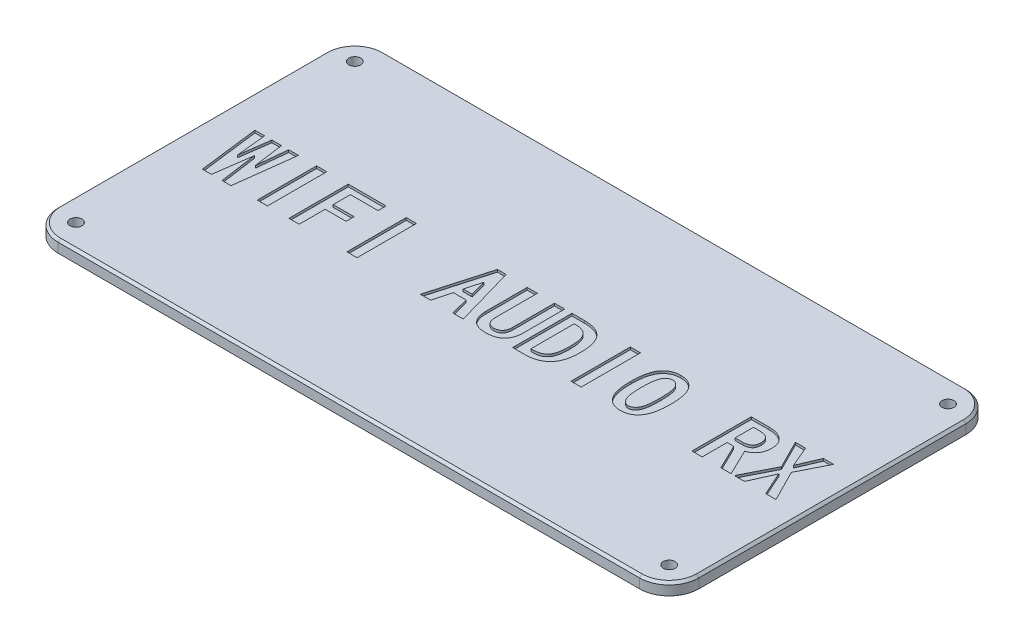
from build123d import *

# Parameters (mm, degrees)
EXTRUDE_1_DEPTH         = 2
SKETCH_2_R              = 1
CUT_EXTRUDE_1_DEPTH     = 2
CHAMFER_1_SIZE          = 0.4
CUT_EXTRUDE_START       = -0.4
CUT_EXTRUDE_2_OUTLINE_W = 1.719253059
CUT_EXTRUDE_2_OUTLINE_H = 10
CUT_EXTRUDE_2_DEPTH     = 0.4


# Read off the part's stored shape, not the designer's step: 切除-拉伸2
with BuildPart() as part:
    # 草图1 → 凸台-拉伸1 (new body)
    with BuildSketch(Plane(origin=(0, 0, 0), x_dir=(1, 0, 0), z_dir=(0, 1, 0))):
        with BuildLine():
            Line((5, 0), (103, 0))
            ThreePointArc((103, 0), (106.535533906, 1.464466094), (108, 5))
            Line((108, 5), (108, 50))
            ThreePointArc((108, 50), (106.535533906, 53.535533906), (103, 55))
            Line((103, 55), (5, 55))
            ThreePointArc((5, 55), (1.464466094, 53.535533906), (0, 50))
            Line((0, 50), (0, 5))
            ThreePointArc((0, 5), (1.464466094, 1.464466094), (5, 0))
        make_face()
    extrude(amount=EXTRUDE_1_DEPTH)

    # 草图2 → 切除-拉伸1 (cut)
    with BuildSketch(Plane(origin=(0, 2, 0), x_dir=(1, 0, 0), z_dir=(0, 1, 0))):
        with Locations(Location((4, 4, 0), (0, 0, 270))):
            Circle(SKETCH_2_R)
        with Locations(Location((4, 51, 0), (0, 0, 270))):
            Circle(SKETCH_2_R)
        with Locations(Location((104, 51, 0), (0, 0, 270))):
            Circle(SKETCH_2_R)
        with Locations(Location((104, 4, 0), (0, 0, 270))):
            Circle(SKETCH_2_R)
    extrude(amount=-CUT_EXTRUDE_1_DEPTH, mode=Mode.SUBTRACT)

    # 倒角1
    chamfer_1_edges = [part.edges().sort_by_distance(p)[0] for p in [
        (106.535533906, 2, -1.464466094),
        (108, 2, -27.5),
        (106.535533906, 2, -53.535533906),
        (54, 2, -55),
        (1.464466094, 2, -53.535533906),
        (0, 2, -27.5),
        (1.464466094, 2, -1.464466094),
        (54, 2, 0),
    ]]
    chamfer(chamfer_1_edges, length=CHAMFER_1_SIZE)

    # 切除-拉伸2 outline → 切除-拉伸2 (cut)
    # profile 1 of 11: a face of its own
    with BuildSketch(Plane(origin=(0, 2, 0), x_dir=(1, 0, 0), z_dir=(0, 1, 0)).offset(CUT_EXTRUDE_START)):
        with BuildLine():
            add(Edge.make_bspline(
                [(92.274759623, 32.541825938), (92.395758709, 32.540026073), (92.63325844, 32.536493258), (92.980362064, 32.501157515), (93.310294433, 32.445631116), (93.622501217, 32.369678066), (93.916277642, 32.267195564), (94.193419921, 32.145888679), (94.453197451, 32.001124187), (94.693158566, 31.834296743), (94.912715593, 31.645541166), (95.102909665, 31.42858605), (95.264653273, 31.18696423), (95.396284975, 30.920597261), (95.496939678, 30.629758131), (95.56979959, 30.31474531), (95.612362483, 29.97448239), (95.61804466, 29.73948626), (95.620971257, 29.618451823)],
                knots=[0, 0, 0, 0, 0.071797487, 0.140925724, 0.206828829, 0.270272655, 0.331376729, 0.391266126, 0.449629048, 0.507587352, 0.564473205, 0.621039575, 0.678279369, 0.73658201, 0.796884002, 0.860542064, 0.92817238, 1, 1, 1, 1], degree=3))
            Line((92.274759623, 32.541825938), (89.293433159, 32.541825938))
            Line((89.293433159, 32.541825938), (89.293433159, 22.541825938))
            Line((89.293433159, 22.541825938), (91.012686217, 22.541825938))
            Line((91.012686217, 22.541825938), (91.012686217, 26.750883676))
            Line((91.012686217, 26.750883676), (92.130951939, 26.750883676))
            Line((92.130951939, 26.750883676), (94.17860165, 22.541825938))
            Line((94.17860165, 22.541825938), (95.904293858, 22.541825938))
            Line((95.904293858, 22.541825938), (93.742885831, 26.980546694))
            add(Edge.make_bspline(
                [(95.620971257, 29.618451823), (95.619866405, 29.524620871), (95.617717962, 29.34216156), (95.585324426, 29.076226713), (95.539800103, 28.824587506), (95.47289472, 28.58749377), (95.387925386, 28.365413057), (95.280538042, 28.160378466), (95.159347267, 27.966816976), (94.969458538, 27.740295589), (94.719943217, 27.492263811), (94.40310234, 27.253789309), (94.079917917, 27.075531174), (93.853170894, 27.011627916), (93.742885831, 26.980546694)],
                knots=[0, 0, 0, 0, 0.080408974, 0.156359555, 0.229399722, 0.299516036, 0.367306859, 0.43288785, 0.497730006, 0.562696851, 0.685906571, 0.798549465, 0.902018626, 1, 1, 1, 1], degree=3))
        make_face()
        with BuildLine():
            add(Edge.make_bspline(
                [(92.33056559, 28.105251566), (92.433891695, 28.109367419), (92.635358047, 28.117392553), (92.92657319, 28.180154809), (93.193933001, 28.287599626), (93.399369095, 28.408112032), (93.545756524, 28.529635555), (93.641927632, 28.638587069), (93.72054911, 28.76493702), (93.788408734, 28.904573471), (93.836695934, 29.061971273), (93.872376328, 29.233705849), (93.897431484, 29.420980607), (93.898841931, 29.551111255), (93.899571815, 29.618451823)],
                knots=[0, 0, 0, 0, 0.124547931, 0.242844898, 0.357085452, 0.470878725, 0.528437209, 0.58590508, 0.645265586, 0.707401916, 0.772619012, 0.843187358, 0.918851918, 1, 1, 1, 1], degree=3))
            Line((92.33056559, 28.105251566), (91.012686217, 28.105251566))
            Line((91.012686217, 28.105251566), (91.012686217, 31.187458048))
            Line((91.012686217, 31.187458048), (91.989290639, 31.187458048))
            add(Edge.make_bspline(
                [(93.899571815, 29.618451823), (93.898576964, 29.67790647), (93.896628273, 29.794364821), (93.874349676, 29.963816555), (93.840007496, 30.123938708), (93.793584758, 30.274850166), (93.731007257, 30.415423496), (93.653267745, 30.544748481), (93.561722786, 30.663392735), (93.459270355, 30.774958131), (93.336616507, 30.871324374), (93.199436831, 30.958389284), (93.041817428, 31.028242438), (92.867885837, 31.089352713), (92.673262037, 31.132986921), (92.460929803, 31.164659389), (92.23075858, 31.184083814), (92.071607306, 31.186307768), (91.989290639, 31.187458048)],
                knots=[0, 0, 0, 0, 0.062951443, 0.123307794, 0.180692636, 0.236308236, 0.290256402, 0.343291675, 0.395744214, 0.448828209, 0.503279857, 0.560484211, 0.620516063, 0.685475163, 0.755523602, 0.83141769, 0.912805385, 1, 1, 1, 1], degree=3))
        make_face(mode=Mode.SUBTRACT)
    # profile 2 of 11: a face of its own
    with BuildSketch(Plane(origin=(0, 2, 0), x_dir=(1, 0, 0), z_dir=(0, 1, 0)).offset(CUT_EXTRUDE_START)):
        with BuildLine():
            add(Edge.make_bspline(
                [(77.277979199, 32.655584255), (77.411955434, 32.651846619), (77.673248065, 32.644557141), (78.052960404, 32.588715246), (78.407685776, 32.493523123), (78.740045824, 32.363251135), (79.045182411, 32.189568171), (79.328024498, 31.981781034), (79.584821398, 31.73502142), (79.816074435, 31.448728051), (80.021167599, 31.120879967), (80.199601763, 30.74880448), (80.348525831, 30.330482101), (80.46960054, 29.866270508), (80.565556784, 29.357102387), (80.632658951, 28.802167679), (80.673815598, 28.201752134), (80.677886362, 27.786226305), (80.679996799, 27.570802113)],
                knots=[0, 0, 0, 0, 0.057802362, 0.11273142, 0.165156482, 0.216010641, 0.26633153, 0.316226286, 0.367105743, 0.419568068, 0.474647899, 0.533611951, 0.597288555, 0.665962198, 0.740442371, 0.820709249, 0.907048943, 1, 1, 1, 1], degree=3))
            add(Edge.make_bspline(
                [(73.955377782, 27.570802113), (73.957209526, 27.789821079), (73.960739232, 28.211862976), (74.005480711, 28.820662655), (74.071594761, 29.381437591), (74.167474607, 29.894459217), (74.290851244, 30.36000431), (74.441919069, 30.77836239), (74.621997922, 31.149198384), (74.831720617, 31.471937856), (75.06609739, 31.751453279), (75.320600544, 31.993961788), (75.596233705, 32.199597155), (75.893721988, 32.365172128), (76.209569197, 32.498867905), (76.548274, 32.589910355), (76.907056938, 32.644000034), (77.152582997, 32.651668024), (77.277979199, 32.655584255)],
                knots=[0, 0, 0, 0, 0.095491604, 0.184008985, 0.266051824, 0.341624472, 0.41140466, 0.475859752, 0.535302059, 0.590773894, 0.643265744, 0.694025655, 0.743759734, 0.792793041, 0.842161712, 0.892950381, 0.945327125, 1, 1, 1, 1], degree=3))
            add(Edge.make_bspline(
                [(77.277979199, 22.428067621), (77.151850275, 22.431784351), (76.905465627, 22.439044742), (76.54657302, 22.495562866), (76.208393126, 22.590097686), (75.891401479, 22.724089637), (75.594283034, 22.894565234), (75.319630328, 23.105567489), (75.065999815, 23.353917608), (74.831679849, 23.639863331), (74.621961649, 23.969001443), (74.442431083, 24.345687335), (74.290806094, 24.768754574), (74.16751264, 25.238610555), (74.071802918, 25.755204216), (74.005453889, 26.318795871), (73.960802529, 26.929031176), (73.95722909, 27.351784431), (73.955377782, 27.570802113)],
                knots=[0, 0, 0, 0, 0.054634439, 0.106724824, 0.156974504, 0.206434745, 0.255462678, 0.305005436, 0.356086938, 0.408961121, 0.464861566, 0.524761641, 0.58938903, 0.659324006, 0.735024887, 0.816853165, 0.905116295, 1, 1, 1, 1], degree=3))
            add(Edge.make_bspline(
                [(80.679996799, 27.570802113), (80.677867995, 27.35466734), (80.673761317, 26.937721512), (80.632788274, 26.334392618), (80.564753942, 25.77695941), (80.47270387, 25.262639953), (80.347503305, 24.795481085), (80.201983771, 24.370426144), (80.023017047, 23.993180052), (79.819047545, 23.658872211), (79.586256593, 23.368181338), (79.33106753, 23.114872779), (79.048306516, 22.903308293), (78.744028984, 22.72642811), (78.411461192, 22.594047936), (78.055862977, 22.497514575), (77.674879954, 22.438335367), (77.412702732, 22.431552893), (77.277979199, 22.428067621)],
                knots=[0, 0, 0, 0, 0.092631858, 0.178696219, 0.259031396, 0.333255065, 0.402434248, 0.466156919, 0.525553907, 0.581043777, 0.633630769, 0.684808419, 0.734734037, 0.784601226, 0.835227375, 0.887675586, 0.942280486, 1, 1, 1, 1], degree=3))
        make_face()
        with BuildLine():
            add(Edge.make_bspline(
                [(77.277979199, 23.782435511), (77.33256425, 23.784220909), (77.440708478, 23.787758151), (77.599329034, 23.824741496), (77.753160738, 23.879779073), (77.899711811, 23.960939808), (78.040939189, 24.063281782), (78.175723648, 24.188469163), (78.305107518, 24.335866524), (78.430396421, 24.508552257), (78.547396848, 24.718240566), (78.640535763, 24.978387439), (78.724664681, 25.285943347), (78.787714245, 25.646225241), (78.842227645, 26.055663647), (78.87562281, 26.516503306), (78.900901082, 27.026768486), (78.902142422, 27.384028083), (78.90279139, 27.570802113)],
                knots=[0, 0, 0, 0, 0.035936664, 0.071197931, 0.10687346, 0.143399994, 0.181246592, 0.221650853, 0.264439433, 0.310403604, 0.362143895, 0.422172202, 0.492108292, 0.572250118, 0.663138505, 0.7644284, 0.876844016, 1, 1, 1, 1], degree=3))
            add(Edge.make_bspline(
                [(75.732583191, 27.570802113), (75.734511737, 27.381189101), (75.738195479, 27.019006851), (75.758073125, 26.501288662), (75.796144859, 26.035773712), (75.848805225, 25.623057928), (75.914994613, 25.262205645), (76.001310045, 24.954729609), (76.095492084, 24.695332822), (76.21552037, 24.48874932), (76.343166695, 24.321855071), (76.469992727, 24.178741515), (76.599005653, 24.057573501), (76.730306106, 23.957561335), (76.863810712, 23.879965312), (76.998680097, 23.821768215), (77.137596986, 23.788856586), (77.231314519, 23.784569951), (77.277979199, 23.782435511)],
                knots=[0, 0, 0, 0, 0.127090223, 0.242756668, 0.347172299, 0.440019481, 0.521558104, 0.592763228, 0.653942454, 0.705926813, 0.752153712, 0.794605084, 0.833961708, 0.870598011, 0.904977416, 0.937216746, 0.968738396, 1, 1, 1, 1], degree=3))
            add(Edge.make_bspline(
                [(77.277979199, 31.301216365), (77.231274566, 31.299189367), (77.137476794, 31.295118511), (76.999040549, 31.260533452), (76.862286967, 31.209041878), (76.727731679, 31.134862927), (76.597642274, 31.037545032), (76.47057646, 30.919546763), (76.342961571, 30.783691778), (76.215530469, 30.623063455), (76.095344224, 30.422988681), (76.001247903, 30.169812587), (75.914322036, 29.867443263), (75.849114976, 29.510628194), (75.795906159, 29.100864452), (75.758120407, 28.638163568), (75.738147867, 28.121885634), (75.734497857, 27.760416185), (75.732583191, 27.570802113)],
                knots=[0, 0, 0, 0, 0.031584383, 0.063431495, 0.096093653, 0.130351727, 0.167076637, 0.205826137, 0.247643444, 0.293195089, 0.344461011, 0.404918503, 0.475460193, 0.557364934, 0.650210001, 0.755220915, 0.871597561, 1, 1, 1, 1], degree=3))
            add(Edge.make_bspline(
                [(78.90279139, 27.570802113), (78.902157602, 27.757577215), (78.900947724, 28.114124062), (78.87559129, 28.622950234), (78.842412942, 29.080968043), (78.787645919, 29.48678358), (78.725137371, 29.842250496), (78.640107323, 30.144525175), (78.548054727, 30.39954652), (78.430346131, 30.603205452), (78.30533527, 30.769765974), (78.174896785, 30.909521559), (78.042862464, 31.032956913), (77.899180685, 31.128343573), (77.753702686, 31.20785442), (77.60010921, 31.261965342), (77.441108856, 31.295074466), (77.332513112, 31.299163141), (77.277979199, 31.301216365)],
                knots=[0, 0, 0, 0, 0.124410113, 0.237494361, 0.339340586, 0.430209388, 0.510230248, 0.579500015, 0.639248908, 0.690268961, 0.735549344, 0.777712068, 0.817533255, 0.855607462, 0.892280538, 0.927709028, 0.963697384, 1, 1, 1, 1], degree=3))
        make_face(mode=Mode.SUBTRACT)
    # profile 3 of 11: a face of its own
    with BuildSketch(Plane(origin=(0, 2, 0), x_dir=(1, 0, 0), z_dir=(0, 1, 0)).offset(CUT_EXTRUDE_START)):
        with BuildLine():
            add(Edge.make_bspline(
                [(61.143615601, 32.541825938), (61.326198891, 32.538141245), (61.680100423, 32.530999196), (62.192239085, 32.475488264), (62.666463294, 32.381767607), (63.102680586, 32.251500582), (63.501583865, 32.083860299), (63.862972763, 31.877463657), (64.185359925, 31.630960116), (64.470270166, 31.345774331), (64.720049905, 31.020105941), (64.931920027, 30.648395371), (65.114560844, 30.235119762), (65.262489088, 29.776125735), (65.374054859, 29.272839466), (65.454607145, 28.725536266), (65.504202665, 28.134065279), (65.510429183, 27.72472716), (65.51365209, 27.512849763)],
                knots=[0, 0, 0, 0, 0.071201178, 0.138009377, 0.200615386, 0.259496855, 0.315264295, 0.369016079, 0.421367624, 0.473064341, 0.525807093, 0.580944039, 0.639536507, 0.701748872, 0.768699696, 0.840366328, 0.917372057, 1, 1, 1, 1], degree=3))
            Line((61.143615601, 32.541825938), (59.072355674, 32.541825938))
            Line((59.072355674, 32.541825938), (59.072355674, 22.541825938))
            Line((59.072355674, 22.541825938), (61.143615601, 22.541825938))
            add(Edge.make_bspline(
                [(65.51365209, 27.512849763), (65.509753581, 27.300973587), (65.502219891, 26.891532561), (65.450080678, 26.300100112), (65.357387169, 25.75500145), (65.2332312, 25.253882408), (65.067825549, 24.798371083), (64.866281607, 24.388279629), (64.629263177, 24.022290157), (64.352197314, 23.704695109), (64.041264475, 23.432149419), (63.708451028, 23.191332028), (63.345755642, 22.99154349), (62.958230528, 22.824431882), (62.541338017, 22.699905705), (62.099389866, 22.606343028), (61.629973863, 22.553551728), (61.308298101, 22.545796329), (61.143615601, 22.541825938)],
                knots=[0, 0, 0, 0, 0.083884036, 0.162102066, 0.234794836, 0.302603191, 0.366226687, 0.426272698, 0.483153898, 0.538366567, 0.592541318, 0.646543992, 0.700689114, 0.756145388, 0.813312224, 0.87264444, 0.934800086, 1, 1, 1, 1], degree=3))
        make_face()
        with BuildLine():
            add(Edge.make_bspline(
                [(61.143615601, 23.896193828), (61.248909015, 23.898628517), (61.453003369, 23.90334777), (61.74888728, 23.940801308), (62.024908372, 23.999167807), (62.279545244, 24.085701217), (62.514389091, 24.195341055), (62.727917469, 24.331880332), (62.922429415, 24.491197845), (63.097634638, 24.676965805), (63.252883776, 24.895308691), (63.382695868, 25.153481426), (63.490779892, 25.450924927), (63.583227065, 25.786587845), (63.652481493, 26.16294536), (63.700244567, 26.578160605), (63.730532382, 27.032329589), (63.734420675, 27.34824247), (63.736446681, 27.512849763)],
                knots=[0, 0, 0, 0, 0.06157925, 0.119361476, 0.17420375, 0.226354123, 0.276345084, 0.325461037, 0.374229775, 0.423086444, 0.474419126, 0.530390201, 0.591577019, 0.659307146, 0.733845725, 0.815199008, 0.903708925, 1, 1, 1, 1], degree=3))
            Line((61.143615601, 23.896193828), (60.791608733, 23.896193828))
            Line((60.791608733, 23.896193828), (60.791608733, 31.187458048))
            Line((60.791608733, 31.187458048), (61.143615601, 31.187458048))
            add(Edge.make_bspline(
                [(63.736446681, 27.512849763), (63.734422629, 27.678173071), (63.730537396, 27.995516534), (63.700208705, 28.451817925), (63.652563106, 28.869207989), (63.582779784, 29.248264236), (63.49094226, 29.588621006), (63.380615296, 29.89051117), (63.250210068, 30.154129019), (63.095718905, 30.378651128), (62.92046183, 30.569898853), (62.7286478, 30.737411132), (62.51397772, 30.877763346), (62.278554568, 30.991463931), (62.023486268, 31.079807484), (61.748346442, 31.140921875), (61.453144194, 31.180844685), (61.248926075, 31.185207993), (61.143615601, 31.187458048)],
                knots=[0, 0, 0, 0, 0.095937682, 0.184155499, 0.265271805, 0.339623548, 0.407614047, 0.469624787, 0.525889424, 0.577833102, 0.627214304, 0.676079586, 0.725254369, 0.775579675, 0.82744862, 0.881538554, 0.938912222, 1, 1, 1, 1], degree=3))
        make_face(mode=Mode.SUBTRACT)
    # profile 4 of 11: a face of its own
    with BuildSketch(Plane(origin=(0, 2, 0), x_dir=(1, 0, 0), z_dir=(0, 1, 0)).offset(CUT_EXTRUDE_START)):
        with BuildLine():
            add(Edge.make_bspline(
                [(57.844624401, 25.523152403), (57.84184302, 25.411466696), (57.836391765, 25.192572818), (57.802706398, 24.871387624), (57.742240365, 24.566375166), (57.659678473, 24.276730164), (57.548203556, 24.005529732), (57.41789168, 23.747590738), (57.260236532, 23.507105161), (57.079977312, 23.282717833), (56.873773391, 23.078113572), (56.634437215, 22.904493568), (56.368527225, 22.75453741), (56.072027993, 22.635883147), (55.748088259, 22.540496507), (55.394783863, 22.47633652), (55.013141951, 22.434061988), (54.748948112, 22.430112387), (54.612171085, 22.428067621)],
                knots=[0, 0, 0, 0, 0.065604887, 0.12857964, 0.189401807, 0.248049595, 0.30517198, 0.361367106, 0.417548089, 0.4737275, 0.530189112, 0.587595214, 0.646861539, 0.709057507, 0.774748476, 0.844887186, 0.91969582, 1, 1, 1, 1], degree=3))
            Line((57.844624401, 25.523152403), (57.844624401, 32.541825938))
            Line((57.844624401, 32.541825938), (56.123224959, 32.541825938))
            Line((56.123224959, 32.541825938), (56.123224959, 25.523152403))
            add(Edge.make_bspline(
                [(54.612171085, 23.782435511), (54.720687071, 23.786940961), (54.929295368, 23.795602121), (55.226536392, 23.87441232), (55.48806707, 24.007871704), (55.67887167, 24.159127288), (55.806557529, 24.308099346), (55.894186167, 24.434933354), (55.963229244, 24.580903918), (56.024239429, 24.738951909), (56.068792453, 24.913387208), (56.100517579, 25.102917565), (56.119751671, 25.308119107), (56.122045533, 25.450133396), (56.123224959, 25.523152403)],
                knots=[0, 0, 0, 0, 0.123775813, 0.23794339, 0.347940895, 0.45718005, 0.513372299, 0.571618332, 0.632646595, 0.697298142, 0.764883334, 0.837828021, 0.916616583, 1, 1, 1, 1], degree=3))
            add(Edge.make_bspline(
                [(53.236339362, 25.523152403), (53.237779109, 25.446582535), (53.240554777, 25.298964639), (53.255920475, 25.086329149), (53.28942011, 24.891531312), (53.331223292, 24.714046709), (53.384406215, 24.552078668), (53.45300597, 24.409090433), (53.532580401, 24.281926863), (53.655610616, 24.140445016), (53.832594475, 23.997275715), (54.071397678, 23.873006138), (54.333909986, 23.793747311), (54.51787253, 23.786268912), (54.612171085, 23.782435511)],
                knots=[0, 0, 0, 0, 0.09101781, 0.175471868, 0.253054426, 0.325649299, 0.392065264, 0.455199651, 0.513697545, 0.569772209, 0.677340989, 0.781931297, 0.888218747, 1, 1, 1, 1], degree=3))
            Line((53.236339362, 25.523152403), (53.236339362, 32.541825938))
            Line((53.236339362, 32.541825938), (51.517086303, 32.541825938))
            Line((51.517086303, 32.541825938), (51.517086303, 25.523152403))
            add(Edge.make_bspline(
                [(54.612171085, 22.428067621), (54.483294639, 22.430436931), (54.233512222, 22.435029019), (53.872147849, 22.473192474), (53.537313003, 22.539427749), (53.2292355, 22.632121229), (52.945459485, 22.746464644), (52.689454176, 22.891776463), (52.461076362, 23.063931844), (52.259550226, 23.261859221), (52.083932474, 23.480769924), (51.932845796, 23.719765284), (51.80317003, 23.976015184), (51.699039658, 24.251177376), (51.616411192, 24.543383885), (51.560218092, 24.853933375), (51.521659879, 25.182340276), (51.518633679, 25.407845583), (51.517086303, 25.523152403)],
                knots=[0, 0, 0, 0, 0.077292091, 0.149803986, 0.217641477, 0.281726179, 0.342535593, 0.40077054, 0.457763532, 0.513604108, 0.569770269, 0.625726167, 0.682920779, 0.741741049, 0.801929414, 0.864805697, 0.930871582, 1, 1, 1, 1], degree=3))
        make_face()
    # profile 5 of 11: a face of its own
    with BuildSketch(Plane(origin=(0, 2, 0), x_dir=(1, 0, 0), z_dir=(0, 1, 0)).offset(CUT_EXTRUDE_START)):
        Polygon((103.459563229, 22.541825938), (100.787315966, 27.796172364), (103.176240628, 32.541825938), (101.448402036, 32.541825938), (99.945933695, 29.015318104), (98.445611738, 32.541825938), (96.734944212, 32.541825938), (99.123868874, 27.798318748), (96.449475228, 22.541825938), (98.160142753, 22.541825938), (99.945933695, 26.523367041), (101.731724637, 22.541825938), align=None)
    # profile 6 of 11: a face of its own
    with BuildSketch(Plane(origin=(0, 2, 0), x_dir=(1, 0, 0), z_dir=(0, 1, 0)).offset(CUT_EXTRUDE_START)):
        with Locations((69.762417919, 27.541825938)):
            Rectangle(CUT_EXTRUDE_2_OUTLINE_W, CUT_EXTRUDE_2_OUTLINE_H)
    # profile 7 of 11: a face of its own
    with BuildSketch(Plane(origin=(0, 2, 0), x_dir=(1, 0, 0), z_dir=(0, 1, 0)).offset(CUT_EXTRUDE_START)):
        Polygon((48.997232257, 22.541825938), (50.744388299, 22.541825938), (47.857502701, 32.655584255), (46.385083727, 32.655584255), (43.506783663, 22.541825938), (45.245354172, 22.541825938), (46.041662392, 25.555348153), (48.200924036, 25.555348153), align=None)
        Polygon((47.885405685, 26.911862427), (46.363619894, 26.911862427), (47.120782922, 29.686883575), align=None, mode=Mode.SUBTRACT)
    # profile 8 of 11: a face of its own
    with BuildSketch(Plane(origin=(0, 2, 0), x_dir=(1, 0, 0), z_dir=(0, 1, 0)).offset(CUT_EXTRUDE_START)):
        with Locations((31.986071064, 27.541825938)):
            Rectangle(CUT_EXTRUDE_2_OUTLINE_W, CUT_EXTRUDE_2_OUTLINE_H)
    # profile 9 of 11: a face of its own
    with BuildSketch(Plane(origin=(0, 2, 0), x_dir=(1, 0, 0), z_dir=(0, 1, 0)).offset(CUT_EXTRUDE_START)):
        Polygon((21.351814786, 22.541825938), (23.073214227, 22.541825938), (23.073214227, 26.92044796), (26.599722062, 26.92044796), (26.599722062, 28.276962233), (23.073214227, 28.276962233), (23.073214227, 31.187458048), (27.737305234, 31.187458048), (27.737305234, 32.541825938), (21.351814786, 32.541825938), align=None)
    # profile 10 of 11: a face of its own
    with BuildSketch(Plane(origin=(0, 2, 0), x_dir=(1, 0, 0), z_dir=(0, 1, 0)).offset(CUT_EXTRUDE_START)):
        with Locations((16.875532322, 27.541825938)):
            Rectangle(CUT_EXTRUDE_2_OUTLINE_W, CUT_EXTRUDE_2_OUTLINE_H)
    # profile 11 of 11: a face of its own
    with BuildSketch(Plane(origin=(0, 2, 0), x_dir=(1, 0, 0), z_dir=(0, 1, 0)).offset(CUT_EXTRUDE_START)):
        Polygon((12.968041444, 32.541825938), (11.317472652, 32.541825938), (10.802614788, 27.449670081), (10.102619679, 32.541825938), (8.477807488, 32.541825938), (7.776049167, 27.449670081), (7.262954515, 32.541825938), (5.61667849, 32.541825938), (6.883044663, 22.428067621), (8.396244921, 22.428067621), (9.290213584, 28.785178112), (10.184182246, 22.428067621), (11.697382504, 22.428067621), align=None)
    extrude(amount=CUT_EXTRUDE_2_DEPTH, mode=Mode.SUBTRACT)


solid = part.part
